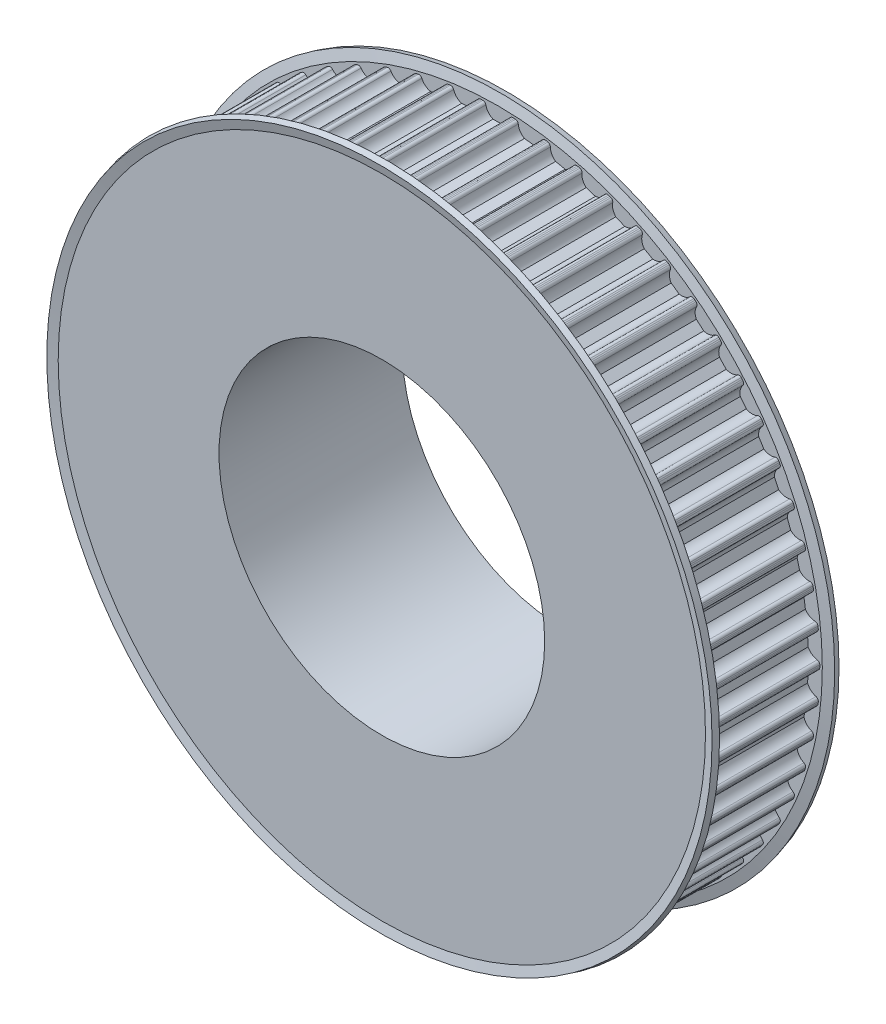
from build123d import *

# Parameters (mm, degrees)
CUT_EXTRUDE1_DEPTH = 122.757956619
CIRPATTERN1_COUNT  = 62


with BuildPart() as part:
    # Sketch1 → Revolve1 (revolve)
    with BuildSketch(Plane(origin=(0, 0, 0), x_dir=(0, 0, -1), z_dir=(1, 0, 0))):
        Polygon((0, 40), (0, 80), (30, 80), (30, 55.5), (45, 55.5), (45, 40), align=None)
    revolve(axis=Axis((0, 0, 55), (0, 0, -1)))

    # Sketch2 → Cut-Extrude1 (cut, through all)
    with BuildSketch(Plane.XY):
        with BuildLine():
            Line((3.674234614, 79), (4.25, 79))
            Line((4.25, 79), (4.25, 81))
            Line((4.25, 81), (-4, 81))
            Line((-4, 81), (-4, 79))
            Line((-4, 79), (-3.674234614, 79))
            ThreePointArc((-3.674234614, 79), (-3.199892965, 78.830947502), (-2.939387691, 78.4))
            ThreePointArc((-2.939387691, 78.4), (-2.331759211, 77.112435701), (-1.198957881, 76.25))
            Line((-1.198957881, 76.25), (1.198957881, 76.25))
            ThreePointArc((1.198957881, 76.25), (2.331759211, 77.112435701), (2.939387691, 78.4))
            ThreePointArc((2.939387691, 78.4), (3.199892965, 78.830947502), (3.674234614, 79))
        make_face()
    cut_extrude1 = extrude(amount=-CUT_EXTRUDE1_DEPTH, mode=Mode.SUBTRACT)

    # CirPattern1: Cut-Extrude1 ×62 about axis
    cirpattern1_axis = Axis((0, 0, 55), (0, 0, -1))
    for i in range(1, CIRPATTERN1_COUNT):
        add(cut_extrude1.rotate(cirpattern1_axis, i * 360 / CIRPATTERN1_COUNT), mode=Mode.SUBTRACT)

    # Sketch3 → Revolve2 (revolve)
    with BuildSketch(Plane(origin=(0, 0, 0), x_dir=(0, 0, -1), z_dir=(1, 0, 0))):
        Polygon((0, 79.502521254), (0, 74.7), (1.5, 74.7), (1.5, 79.7), (0.856921938, 82.1), (-0.591966801, 81.711771432), align=None)
        Polygon((30.591966801, 81.711771432), (29.143078062, 82.1), (28.5, 79.7), (28.5, 74.7), (30, 74.7), (30, 79.502521254), align=None)
    revolve(axis=Axis((0, 0, 55), (0, 0, -1)))


solid = part.part
